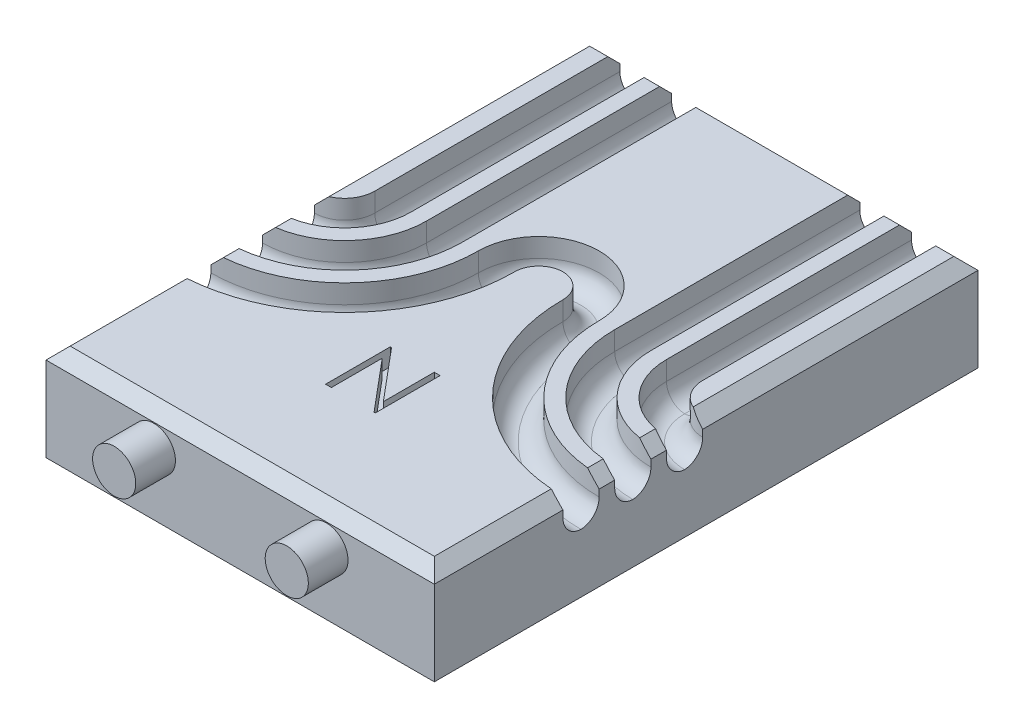
from build123d import *

# Parameters (mm, degrees)
SKETCH1_W                 = 57.15
SKETCH1_H                 = 80.01
BOSS_EXTRUDE1_DEPTH       = 14.224
F_2_56_TAPPED_HOLE1_D     = 1.778
F_2_56_TAPPED_HOLE1_DEPTH = 5.588
F_2_56_TAPPED_HOLE1_TIP   = 0.53416509
CHAMFER1_SIZE             = 1.778
SKETCH4_W                 = 52.523792639
SKETCH4_H                 = 73.533309695
CUT_EXTRUDE1_DEPTH        = 2.54
SKETCH5_R                 = 3.175
BOSS_EXTRUDE2_DEPTH       = 5.842
CUT_EXTRUDE2_DEPTH        = 5.588
FILLET1_R                 = 2.794
CUT_EXTRUDE3_DEPTH        = 2.54


with BuildPart() as part:
    # Sketch1 → Boss-Extrude1 (new body)
    with BuildSketch(Plane(origin=(0, 0, 0), x_dir=(1, 0, 0), z_dir=(0, 1, 0))):
        Rectangle(SKETCH1_W, SKETCH1_H)
    extrude(amount=BOSS_EXTRUDE1_DEPTH)

    # #2-56 Tapped Hole1
    with Locations(Plane.XZ):
        with Locations((-20.6375, -37.9476), (-21.8694, 25.8318), (21.8694, 25.8318), (20.6375, -37.9476)):
            Hole(F_2_56_TAPPED_HOLE1_D / 2, depth=F_2_56_TAPPED_HOLE1_DEPTH)
            with Locations((0, 0, -(F_2_56_TAPPED_HOLE1_DEPTH + F_2_56_TAPPED_HOLE1_TIP / 2))):  # 118° drill point
                Cone(0, F_2_56_TAPPED_HOLE1_D / 2, F_2_56_TAPPED_HOLE1_TIP, mode=Mode.SUBTRACT)

    # Chamfer1
    chamfer1_edges = [part.edges().sort_by_distance(p)[0] for p in [
        (-28.575, 14.224, 0),
        (0, 14.224, 40.005),
        (28.575, 14.224, 0),
        (0, 14.224, -40.005),
    ]]
    chamfer(chamfer1_edges, length=CHAMFER1_SIZE)

    # Sketch4 → Cut-Extrude1 (cut)
    with BuildSketch(Plane.XZ):
        with Locations((-0.054148239, 0.758075358)):
            Rectangle(SKETCH4_W, SKETCH4_H)
    extrude(amount=-CUT_EXTRUDE1_DEPTH, mode=Mode.SUBTRACT)

    # Sketch5 → Boss-Extrude2 (add)
    with BuildSketch(Plane.XY.offset(40.005)):
        with Locations(Location((-12.7, 9.144, 0), (0, 0, 180))):
            Circle(SKETCH5_R)
        with Locations(Location((12.7, 9.144, 0), (0, 0, 180))):
            Circle(SKETCH5_R)
    extrude(amount=BOSS_EXTRUDE2_DEPTH)

    # Sketch6 → Cut-Extrude2 (cut)
    with BuildSketch(Plane(origin=(0, 14.224, 0), x_dir=(1, 0, 0), z_dir=(0, 1, 0))):
        with BuildLine():
            Line((18.796, 40.005), (18.796, 3.937))
            ThreePointArc((18.796, 3.937), (21.660202787, -2.977797213), (28.575, -5.842))
            Line((28.575, -5.842), (28.575, -0.508))
            ThreePointArc((28.575, -0.508), (25.431910358, 0.793910358), (24.13, 3.937))
            Line((24.13, 3.937), (24.13, 40.005))
            Line((24.13, 40.005), (18.796, 40.005))
        make_face()
        with BuildLine():
            Line((11.176, 40.005), (11.176, 3.937))
            ThreePointArc((11.176, 3.937), (16.272049114, -8.365950886), (28.575, -13.462))
            Line((28.575, -13.462), (28.575, -8.128))
            ThreePointArc((28.575, -8.128), (20.043756685, -4.594243315), (16.51, 3.937))
            Line((16.51, 3.937), (16.51, 40.005))
            Line((16.51, 40.005), (11.176, 40.005))
        make_face()
        with BuildLine():
            Line((28.575, -15.748), (28.575, -21.082))
            ThreePointArc((28.575, -21.082), (10.883895441, -13.754104559), (3.556, 3.937))
            ThreePointArc((3.556, 3.937), (2.514471714, 6.451471714), (0, 7.493))
            Line((0, 7.493), (0, 12.827))
            ThreePointArc((0, 12.827), (6.286179285, 10.223179285), (8.89, 3.937))
            ThreePointArc((8.89, 3.937), (14.655603012, -9.982396988), (28.575, -15.748))
        make_face()
    cut_extrude2 = extrude(amount=-CUT_EXTRUDE2_DEPTH, mode=Mode.SUBTRACT)

    # Mirror1: Cut-Extrude2 across plane
    add(cut_extrude2.mirror(Plane(origin=(0, 0, 0), x_dir=(0, 0, 1), z_dir=(1, 0, 0))), mode=Mode.SUBTRACT)

    # Fillet1
    # the kernel refuses this fillet: 2.794 mm, written as the material it adds along each edge
    with BuildSketch(Plane(origin=(-28.575, 8.636, -3.937), x_dir=(1, 0, 0), z_dir=(0, 0, -1))) as fillet1_piece_1:
        with BuildLine():
            CenterArc((9.779 - FILLET1_R, -FILLET1_R), FILLET1_R, 0, 90)
            Line((9.779, -FILLET1_R), (9.779, 0))
            Line((9.779, 0), (9.779 - FILLET1_R, 0))
        make_face()
    revolve(axis=Axis((-28.575, 8.636, -3.937), (0, -1, 0)), revolution_arc=90)
    with BuildSketch(Plane(origin=(-28.575, 8.636, -3.937), x_dir=(0, 0, 1), z_dir=(-1, 0, 0))) as fillet1_piece_2:
        with BuildLine():
            CenterArc((4.445 + FILLET1_R, FILLET1_R), FILLET1_R, 180, 90)
            Line((4.445 + FILLET1_R, 0), (4.445, 0))
            Line((4.445, 0), (4.445, FILLET1_R))
        make_face()
    revolve(axis=Axis((-28.575, 8.636, -3.937), (0, 1, 0)), revolution_arc=90)
    with BuildSketch(Plane(origin=(-28.575, 8.636, -3.937), x_dir=(0, 0, 1), z_dir=(-1, 0, 0))) as fillet1_piece_3:
        with BuildLine():
            CenterArc((12.065 + FILLET1_R, FILLET1_R), FILLET1_R, 180, 90)
            Line((12.065 + FILLET1_R, 0), (12.065, 0))
            Line((12.065, 0), (12.065, FILLET1_R))
        make_face()
    revolve(axis=Axis((-28.575, 8.636, -3.937), (0, 1, 0)), revolution_arc=90)
    with BuildSketch(Plane(origin=(-28.575, 8.636, -3.937), x_dir=(1, 0, 0), z_dir=(0, 0, -1))) as fillet1_piece_4:
        with BuildLine():
            CenterArc((17.399 - FILLET1_R, -FILLET1_R), FILLET1_R, 0, 90)
            Line((17.399, -FILLET1_R), (17.399, 0))
            Line((17.399, 0), (17.399 - FILLET1_R, 0))
        make_face()
    revolve(axis=Axis((-28.575, 8.636, -3.937), (0, -1, 0)), revolution_arc=90)
    with BuildSketch(Plane(origin=(28.575, 8.636, -3.937), x_dir=(0, 0, 1), z_dir=(1, 0, 0))) as fillet1_piece_5:
        with BuildLine():
            CenterArc((25.019 - FILLET1_R, -FILLET1_R), FILLET1_R, 0, 90)
            Line((25.019, -FILLET1_R), (25.019, 0))
            Line((25.019, 0), (25.019 - FILLET1_R, 0))
        make_face()
    revolve(axis=Axis((28.575, 8.636, -3.937), (0, -1, 0)), revolution_arc=90)
    with BuildSketch(Plane(origin=(0, 8.636, -3.937), x_dir=(-1, 0, 0), z_dir=(0, 0, 1))) as fillet1_piece_6:
        with BuildLine():
            CenterArc((3.556 + FILLET1_R, -FILLET1_R), FILLET1_R, 90, 90)
            Line((3.556, -FILLET1_R), (3.556, 0))
            Line((3.556, 0), (3.556 + FILLET1_R, 0))
        make_face()
    revolve(axis=Axis((0, 8.636, -3.937), (0, -1, 0)), revolution_arc=180)
    with BuildSketch(Plane(origin=(28.575, 8.636, -3.937), x_dir=(-1, 0, 0), z_dir=(0, 0, -1))) as fillet1_piece_7:
        with BuildLine():
            CenterArc((19.685 + FILLET1_R, FILLET1_R), FILLET1_R, 180, 90)
            Line((19.685 + FILLET1_R, 0), (19.685, 0))
            Line((19.685, 0), (19.685, FILLET1_R))
        make_face()
    revolve(axis=Axis((28.575, 8.636, -3.937), (0, 1, 0)), revolution_arc=90)
    with BuildSketch(Plane(origin=(-28.575, 8.636, -3.937), x_dir=(1, 0, 0), z_dir=(0, 0, -1))) as fillet1_piece_8:
        with BuildLine():
            CenterArc((19.685 + FILLET1_R, -FILLET1_R), FILLET1_R, 90, 90)
            Line((19.685 + FILLET1_R, 0), (19.685, 0))
            Line((19.685, 0), (19.685, -FILLET1_R))
        make_face()
    revolve(axis=Axis((-28.575, 8.636, -3.937), (0, -1, 0)), revolution_arc=90)
    with BuildSketch(Plane(origin=(28.575, 8.636, -3.937), x_dir=(0, 0, 1), z_dir=(1, 0, 0))) as fillet1_piece_9:
        with BuildLine():
            CenterArc((12.065 + FILLET1_R, -FILLET1_R), FILLET1_R, 90, 90)
            Line((12.065, -FILLET1_R), (12.065, 0))
            Line((12.065, 0), (12.065 + FILLET1_R, 0))
        make_face()
    revolve(axis=Axis((28.575, 8.636, -3.937), (0, -1, 0)), revolution_arc=90)
    with BuildSketch(Plane(origin=(28.575, 8.636, -3.937), x_dir=(-1, 0, 0), z_dir=(0, 0, -1))) as fillet1_piece_10:
        with BuildLine():
            CenterArc((17.399 - FILLET1_R, FILLET1_R), FILLET1_R, 270, 90)
            Line((17.399 - FILLET1_R, 0), (17.399, 0))
            Line((17.399, 0), (17.399, FILLET1_R))
        make_face()
    revolve(axis=Axis((28.575, 8.636, -3.937), (0, 1, 0)), revolution_arc=90)
    with BuildSketch(Plane(origin=(28.575, 8.636, -3.937), x_dir=(-1, 0, 0), z_dir=(0, 0, -1))) as fillet1_piece_11:
        with BuildLine():
            CenterArc((9.779 - FILLET1_R, FILLET1_R), FILLET1_R, 270, 90)
            Line((9.779 - FILLET1_R, 0), (9.779, 0))
            Line((9.779, 0), (9.779, FILLET1_R))
        make_face()
    revolve(axis=Axis((28.575, 8.636, -3.937), (0, 1, 0)), revolution_arc=90)
    with BuildSketch(Plane(origin=(28.575, 8.636, -3.937), x_dir=(0, 0, 1), z_dir=(1, 0, 0))) as fillet1_piece_12:
        with BuildLine():
            CenterArc((4.445 + FILLET1_R, -FILLET1_R), FILLET1_R, 90, 90)
            Line((4.445, -FILLET1_R), (4.445, 0))
            Line((4.445, 0), (4.445 + FILLET1_R, 0))
        make_face()
    revolve(axis=Axis((28.575, 8.636, -3.937), (0, -1, 0)), revolution_arc=90)
    with BuildSketch(Plane(origin=(-18.796, 8.636, -40.005), x_dir=(-1, 0, 0), z_dir=(0, 0, 1)), Plane(origin=(-11.176, 8.636, -40.005), x_dir=(-1, 0, 0), z_dir=(0, 0, 1)), Plane(origin=(11.176, 8.636, -40.005), x_dir=(0, 1, 0), z_dir=(0, 0, 1)), Plane(origin=(18.796, 8.636, -40.005), x_dir=(0, 1, 0), z_dir=(0, 0, 1))) as fillet1_piece_13:
        with BuildLine():
            CenterArc((FILLET1_R, -FILLET1_R), FILLET1_R, 90, 90)
            Line((0, -FILLET1_R), (0, 0))
            Line((0, 0), (FILLET1_R, 0))
        make_face()
    extrude(amount=36.068)
    with BuildSketch(Plane(origin=(-24.13, 8.636, -3.937), x_dir=(0, 1, 0), z_dir=(0, 0, -1)), Plane(origin=(-16.51, 8.636, -3.937), x_dir=(0, 1, 0), z_dir=(0, 0, -1)), Plane(origin=(16.51, 8.636, -3.937), x_dir=(-1, 0, 0), z_dir=(0, 0, -1)), Plane(origin=(24.13, 8.636, -3.937), x_dir=(-1, 0, 0), z_dir=(0, 0, -1))) as fillet1_piece_14:
        with BuildLine():
            CenterArc((FILLET1_R, FILLET1_R), FILLET1_R, 180, 90)
            Line((0, FILLET1_R), (0, 0))
            Line((0, 0), (FILLET1_R, 0))
        make_face()
    extrude(amount=36.068)
    with BuildSketch(Plane(origin=(-28.575, 8.636, -3.937), x_dir=(0, 0, 1), z_dir=(-1, 0, 0))) as fillet1_piece_15:
        with BuildLine():
            CenterArc((25.019 - FILLET1_R, FILLET1_R), FILLET1_R, 270, 90)
            Line((25.019, FILLET1_R), (25.019, 0))
            Line((25.019, 0), (25.019 - FILLET1_R, 0))
        make_face()
    revolve(axis=Axis((-28.575, 8.636, -3.937), (0, 1, 0)), revolution_arc=90)
    with BuildSketch(Plane(origin=(0, 8.636, -3.937), x_dir=(1, 0, 0), z_dir=(0, 0, 1))) as fillet1_piece_16:
        with BuildLine():
            CenterArc((8.89 - FILLET1_R, FILLET1_R), FILLET1_R, 270, 90)
            Line((8.89 - FILLET1_R, 0), (8.89, 0))
            Line((8.89, 0), (8.89, FILLET1_R))
        make_face()
    revolve(axis=Axis((0, 8.636, -3.937), (0, 1, 0)), revolution_arc=180)

    # Sketch7 → Cut-Extrude3 (cut)
    with BuildSketch(Plane(origin=(0, 14.224, 0), x_dir=(1, 0, 0), z_dir=(0, 1, 0))):
        Polygon((-3.141927936, -24.288971493), (-3.141927936, -14.763971493), (-2.962570965, -14.763971493), (3.330187448, -22.260711276), (3.330187448, -14.763971493), (4.18499514, -14.763971493), (4.18499514, -24.288971493), (3.990373746, -24.288971493), (-2.287120244, -16.809404185), (-2.287120244, -24.288971493), align=None)
    extrude(amount=-CUT_EXTRUDE3_DEPTH, mode=Mode.SUBTRACT)


solid = part.part
